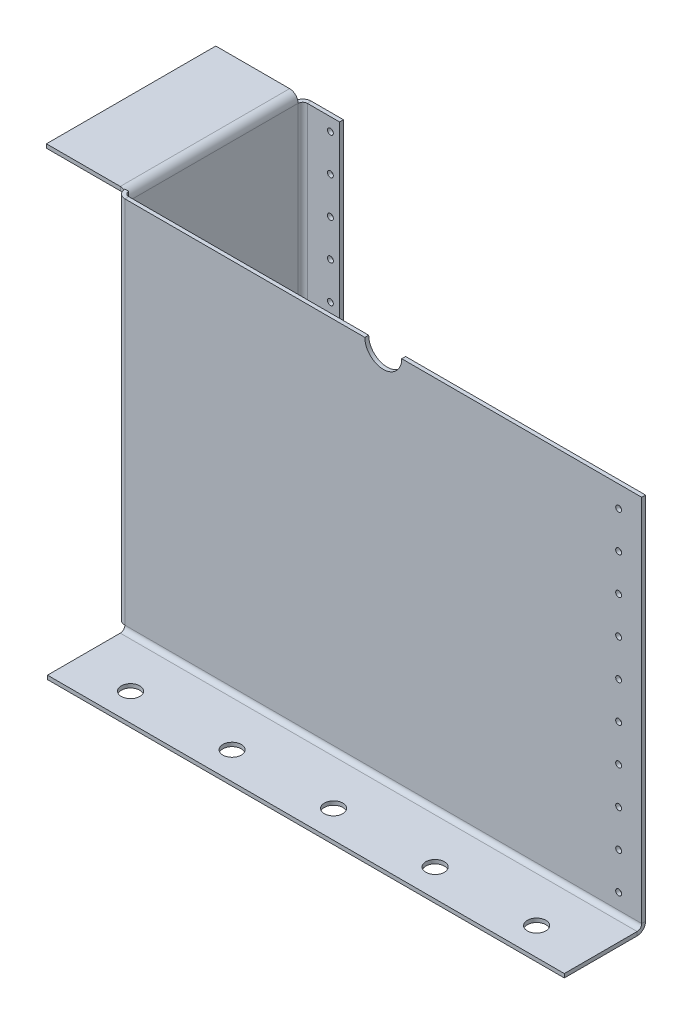
from build123d import *

# Parameters (mm, degrees)
BASE_FLANGE1_DEPTH           = 2.65684
SKETCHED_BEND3_DEPTH         = 355.6
SKETCHED_BEND3_2_DEPTH       = 355.6
SKETCH10_R                   = 6.35
CUT_EXTRUDE2_DEPTH           = 2.65684
EDGE_FLANGE5_DEPTH           = 254
EDGE_FLANGE6_STRIP_W         = 16.97736
EDGE_FLANGE6_STRIP_H         = 2.65684
EDGE_FLANGE6_STRIP_CUT_DEPTH = 116.5225
EDGE_FLANGE6_DEPTH           = 116.5225
EDGE_FLANGE7_DEPTH           = 248.16816
SKETCH38_R                   = 2.032
CUT_EXTRUDE4_DEPTH           = 2.65684
SKETCH39_R                   = 2.032
CUT_EXTRUDE5_DEPTH           = 2.65684
SKETCH40_R                   = 6.35
CUT_EXTRUDE6_DEPTH           = 2.65684


# Read off the part's stored shape, not the designer's step: Sketched Bend3
# Sheet-metal steps are written as plain solids
with BuildPart() as part:
    # Sketch1 → Base-Flange1 (new body)
    with BuildSketch(Plane.XY):
        with BuildLine():
            Line((0, 0), (0, 254))
            Line((0, 254), (165.1, 254))
            ThreePointArc((165.1, 254), (177.8, 241.3), (190.5, 254))
            Line((190.5, 254), (355.6, 254))
            Line((355.6, 254), (355.6, 0))
            Line((355.6, 0), (355.6, -57.15))
            Line((355.6, -57.15), (0, -57.15))
            Line((0, -57.15), (0, 0))
        make_face()
    extrude(amount=-BASE_FLANGE1_DEPTH)

    # Sketched Bend3 outline → Sketched Bend3 (cut)
    with BuildSketch(Plane.YZ):
        with BuildLine():
            ThreePointArc((0, -2.65684), (-2.783367186, -1.949765838), (-4.891802611, 0))
            Line((-4.891802611, 0), (-57.15, 0))
            Line((-57.15, 0), (-57.15, -2.65684))
            Line((-57.15, -2.65684), (0, -2.65684))
        make_face()
    extrude(amount=SKETCHED_BEND3_DEPTH, mode=Mode.SUBTRACT)

    # Sketched Bend3 2 outline → Sketched Bend3 2 (add)
    with BuildSketch(Plane.YZ):
        with BuildLine():
            ThreePointArc((0, 0), (-2.24506403, 0.92993597), (-3.175, 3.175))
            Line((-3.175, 3.175), (-3.175, 53.251044406))
            Line((-3.175, 53.251044406), (-5.83184, 53.251044406))
            Line((-5.83184, 53.251044406), (-5.83184, 3.175))
            ThreePointArc((-5.83184, 3.175), (-5.591894488, 1.519381136), (-4.891802611, 0))
            Line((-4.891802611, 0), (0, 0))
        make_face()
    extrude(amount=SKETCHED_BEND3_2_DEPTH)

    # Sketch10 → Cut-Extrude2 (cut)
    with BuildSketch(Plane(origin=(0, -3.175, 0), x_dir=(1, 0, 0), z_dir=(0, 1, 0))):
        with Locations(Location((317.5, -34.201044406, 0), (0, 0, 270))):
            Circle(SKETCH10_R)
        with Locations(Location((247.65, -34.201044406, 0), (0, 0, 270))):
            Circle(SKETCH10_R)
        with Locations(Location((38.1, -34.201044406, 0), (0, 0, 270))):
            Circle(SKETCH10_R)
        with Locations(Location((107.95, -34.201044406, 0), (0, 0, 270))):
            Circle(SKETCH10_R)
        with Locations(Location((177.8, -34.201044406, 0), (0, 0, 270))):
            Circle(SKETCH10_R)
    extrude(amount=-CUT_EXTRUDE2_DEPTH, mode=Mode.SUBTRACT)

    # Edge-Flange5 section (across the edge) → Edge-Flange5 (add)
    with BuildSketch(Plane(origin=(-3.175, 0, -2.65684), x_dir=(1, 0, 0), z_dir=(0, 1, 0))):
        with BuildLine():
            Line((-2.65684, 3.175), (-2.65684, 119.6975))
            Line((-2.65684, 119.6975), (0, 119.6975))
            Line((0, 119.6975), (0, 3.175))
            ThreePointArc((0, 3.175), (0.92993597, 0.92993597), (3.175, 0))
            Line((3.175, 0), (3.175, -2.65684))
            ThreePointArc((3.175, -2.65684), (-0.948733611, -0.948733611), (-2.65684, 3.175))
        make_face()
    extrude(amount=EDGE_FLANGE5_DEPTH)

    # Edge-Flange6 strip (across the edge) → Edge-Flange6 strip cut (cut)
    with BuildSketch(Plane(origin=(-5.83184, 254, -5.83184), x_dir=(0, -1, 0), z_dir=(0, 0, -1))):
        with Locations((-2.65684, -1.32842)):
            Rectangle(EDGE_FLANGE6_STRIP_W, EDGE_FLANGE6_STRIP_H)
    extrude(amount=EDGE_FLANGE6_STRIP_CUT_DEPTH, mode=Mode.SUBTRACT)

    # Edge-Flange6 section (across the edge) → Edge-Flange6 (add)
    with BuildSketch(Plane(origin=(-5.83184, 254, -5.83184), x_dir=(0, -1, 0), z_dir=(0, 0, -1))):
        with BuildLine():
            Line((0, 3.175), (0, 53.975))
            Line((0, 53.975), (2.65684, 53.975))
            Line((2.65684, 53.975), (2.65684, 3.175))
            ThreePointArc((2.65684, 3.175), (3.58677597, 0.92993597), (5.83184, 0))
            Line((5.83184, 0), (5.83184, -2.65684))
            ThreePointArc((5.83184, -2.65684), (1.708106389, -0.948733611), (0, 3.175))
        make_face()
    extrude(amount=EDGE_FLANGE6_DEPTH)

    # Edge-Flange7 section (across the edge) → Edge-Flange7 (add)
    with BuildSketch(Plane(origin=(-3.175, 0, -125.52934), x_dir=(0, 0, 1), z_dir=(0, 1, 0))):
        with BuildLine():
            Line((-2.65684, 3.175), (-2.65684, 25.4))
            Line((-2.65684, 25.4), (0, 25.4))
            Line((0, 25.4), (0, 3.175))
            ThreePointArc((0, 3.175), (0.92993597, 0.92993597), (3.175, 0))
            Line((3.175, 0), (3.175, -2.65684))
            ThreePointArc((3.175, -2.65684), (-0.948733611, -0.948733611), (-2.65684, 3.175))
        make_face()
    extrude(amount=EDGE_FLANGE7_DEPTH)

    # Sketch38 → Cut-Extrude4 (cut)
    with BuildSketch(Plane(origin=(0, 0, -128.18618), x_dir=(-1, 0, 0), z_dir=(0, 0, -1))):
        with Locations((-15.875, 239.27816)):
            Circle(SKETCH38_R)
        with Locations((-15.875, 213.87816)):
            Circle(SKETCH38_R)
        with Locations((-15.875, 188.47816)):
            Circle(SKETCH38_R)
        with Locations((-15.875, 163.07816)):
            Circle(SKETCH38_R)
        with Locations((-15.875, 137.67816)):
            Circle(SKETCH38_R)
        with Locations((-15.875, 112.27816)):
            Circle(SKETCH38_R)
        with Locations((-15.875, 86.87816)):
            Circle(SKETCH38_R)
        with Locations((-15.875, 61.47816)):
            Circle(SKETCH38_R)
        with Locations((-15.875, 36.07816)):
            Circle(SKETCH38_R)
        with Locations((-15.875, 10.67816)):
            Circle(SKETCH38_R)
    extrude(amount=-CUT_EXTRUDE4_DEPTH, mode=Mode.SUBTRACT)

    # Sketch39 → Cut-Extrude5 (cut)
    with BuildSketch(Plane.XY):
        with Locations((339.725, 10.67816)):
            Circle(SKETCH39_R)
        with Locations((339.725, 36.07816)):
            Circle(SKETCH39_R)
        with Locations((339.725, 61.47816)):
            Circle(SKETCH39_R)
        with Locations((339.725, 86.87816)):
            Circle(SKETCH39_R)
        with Locations((339.725, 112.27816)):
            Circle(SKETCH39_R)
        with Locations((339.725, 137.67816)):
            Circle(SKETCH39_R)
        with Locations((339.725, 163.07816)):
            Circle(SKETCH39_R)
        with Locations((339.725, 188.47816)):
            Circle(SKETCH39_R)
        with Locations((339.725, 213.87816)):
            Circle(SKETCH39_R)
        with Locations((339.725, 239.27816)):
            Circle(SKETCH39_R)
    extrude(amount=-CUT_EXTRUDE5_DEPTH, mode=Mode.SUBTRACT)

    # Sketch40 → Cut-Extrude6 (cut)
    with BuildSketch(Plane.ZY.offset(5.83184)):
        with Locations((-34.40684, 41.79316)):
            Circle(SKETCH40_R)
        with Locations((-90.28684, 41.79316)):
            Circle(SKETCH40_R)
    extrude(amount=-CUT_EXTRUDE6_DEPTH, mode=Mode.SUBTRACT)


solid = part.part
